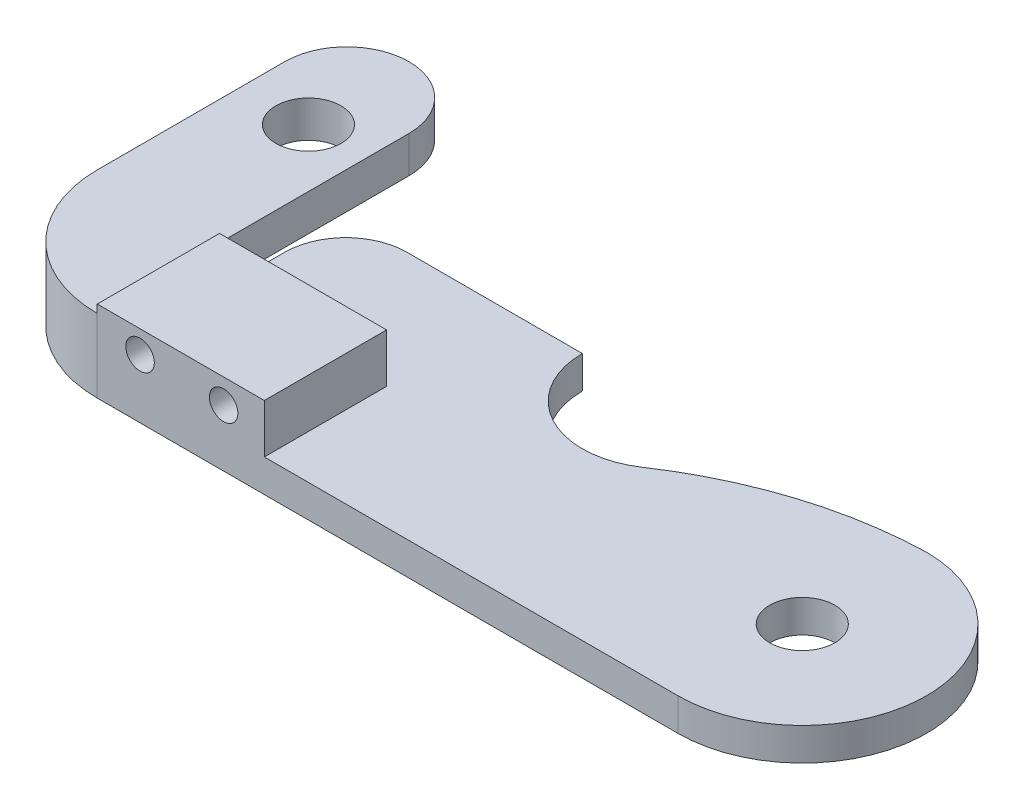
from build123d import *

# Parameters (mm, degrees)
SKETCH1_R           = 1.6
BOSS_EXTRUDE1_DEPTH = 1.6
SKETCH2_W           = 8.2
SKETCH2_H           = 6
BOSS_EXTRUDE2_DEPTH = 2.4
SKETCH3_R           = 0.7
CUT_EXTRUDE1_DEPTH  = 6
BOSS_EXTRUDE3_DEPTH = 3.6
SKETCH5_W           = 6.1
SKETCH5_H           = 1.8
BOSS_EXTRUDE4_DEPTH = 9.2
BOSS_EXTRUDE5_DEPTH = 1.8
SKETCH7_R           = 1.6
CUT_EXTRUDE2_DEPTH  = 1.8
FILLET1_R           = 20


with BuildPart() as part:
    # Sketch1 → Boss-Extrude1 (new body)
    with BuildSketch(Plane(origin=(0, 0, 0), x_dir=(1, 0, 0), z_dir=(0, 1, 0))):
        with BuildLine():
            Line((-13.686930091, -1.927431611), (14.813069909, -1.927431611))
            ThreePointArc((14.813069909, -1.927431611), (20.913069909, 4.172568389), (14.813069909, 10.272568389))
            Line((14.813069909, 10.272568389), (6.020069909, 10.272568389))
            ThreePointArc((6.020069909, 10.272568389), (1.970069909, 6.222568389), (-2.079930091, 10.272568389))
            Line((-2.079930091, 10.272568389), (-10.686930091, 10.272568389))
            ThreePointArc((-10.686930091, 10.272568389), (-12.808250435, 9.393888733), (-13.686930091, 7.272568389))
            Line((-13.686930091, 7.272568389), (-13.686930091, 4.172568389))
            Line((-13.686930091, 4.172568389), (-13.686930091, -1.927431611))
        make_face()
        with Locations(Location((14.813069909, 4.172568389, 0), (0, 0, 270))):
            Circle(SKETCH1_R, mode=Mode.SUBTRACT)
    extrude(amount=BOSS_EXTRUDE1_DEPTH)

    # Sketch2 → Boss-Extrude2 (add)
    with BuildSketch(Plane(origin=(0, 1.6, 0), x_dir=(1, 0, 0), z_dir=(0, 1, 0))):
        with Locations((-9.586930091, 1.072568389)):
            Rectangle(SKETCH2_W, SKETCH2_H)
    extrude(amount=BOSS_EXTRUDE2_DEPTH)

    # Sketch3 → Cut-Extrude1 (cut)
    with BuildSketch(Plane.XY.offset(1.927431611)):
        with Locations((-11.585711123, 2.899970269)):
            Circle(SKETCH3_R)
        with Locations((-7.486930091, 2.8)):
            Circle(SKETCH3_R)
    extrude(amount=-CUT_EXTRUDE1_DEPTH, mode=Mode.SUBTRACT)



with BuildPart() as body_2:
    # Sketch4 → Boss-Extrude3 (new body)
    with BuildSketch(Plane.XZ):
        with BuildLine():
            Line((-13.686930091, 1.927431611), (-13.686930091, -4.172568389))
            Line((-13.686930091, -4.172568389), (-19.786930091, -4.172568389))
            ThreePointArc((-19.786930091, -4.172568389), (-18.000281456, 0.140782976), (-13.686930091, 1.927431611))
        make_face()
    extrude(amount=-BOSS_EXTRUDE3_DEPTH)


with BuildPart() as part_1:
    add(part.part)

    add(body_2.part)  # Boss-Extrude4 merges body 2
    # Sketch5 → Boss-Extrude4 (add)
    with BuildSketch(Plane(origin=(0, 0, -4.172568389), x_dir=(-1, 0, 0), z_dir=(0, 0, -1))):
        with Locations((16.736930091, 2.7)):
            Rectangle(SKETCH5_W, SKETCH5_H)
    extrude(amount=BOSS_EXTRUDE4_DEPTH)

    # Sketch6 → Boss-Extrude5 (add)
    with BuildSketch(Plane(origin=(0, 3.6, 0), x_dir=(1, 0, 0), z_dir=(0, 1, 0))):
        with BuildLine():
            Line((-19.786930091, 13.372568389), (-13.686930091, 13.372568389))
            ThreePointArc((-13.686930091, 13.372568389), (-16.736930091, 16.422568389), (-19.786930091, 13.372568389))
        make_face()
    extrude(amount=-BOSS_EXTRUDE5_DEPTH)

    # Sketch7 → Cut-Extrude2 (cut)
    with BuildSketch(Plane(origin=(0, 3.6, 0), x_dir=(1, 0, 0), z_dir=(0, 1, 0))):
        with Locations(Location((-16.530026975, 11.280054915, 0), (0, 0, 270))):
            Circle(SKETCH7_R)
    extrude(amount=-CUT_EXTRUDE2_DEPTH, mode=Mode.SUBTRACT)

    # Fillet1
    # the kernel refuses this fillet: 20 mm, written as the material it takes off along each edge
    with BuildSketch(Plane(origin=(6.020069909, -21.9825, -10.272568389), x_dir=(-0.47127431381884255, 0, 0.8819866898851587), z_dir=(0, 1, 0))) as fillet1_piece_1:
        with BuildLine():
            CenterArc((13.242808218, 17.639733798), FILLET1_R, 209.618411235, 32.264541926)
            Line((-4.143915041, 7.755308964), (-4.491649507, 7.557620467))
            ThreePointArc((-4.491649507, 7.557620467), (-2.424752197, 3.689144757), (-0.352794676, -0.188509726))
            Line((-0.352794676, -0.188509726), (0.188509726, -0.352794676))
            ThreePointArc((0.188509726, -0.352794676), (1.908660971, 0.077953906), (3.628812216, -0.352794676))
            Line((3.628812216, -0.352794676), (3.817321942, 0))
        make_face()
    extrude(amount=45.565, mode=Mode.SUBTRACT)


solid = part_1.part
